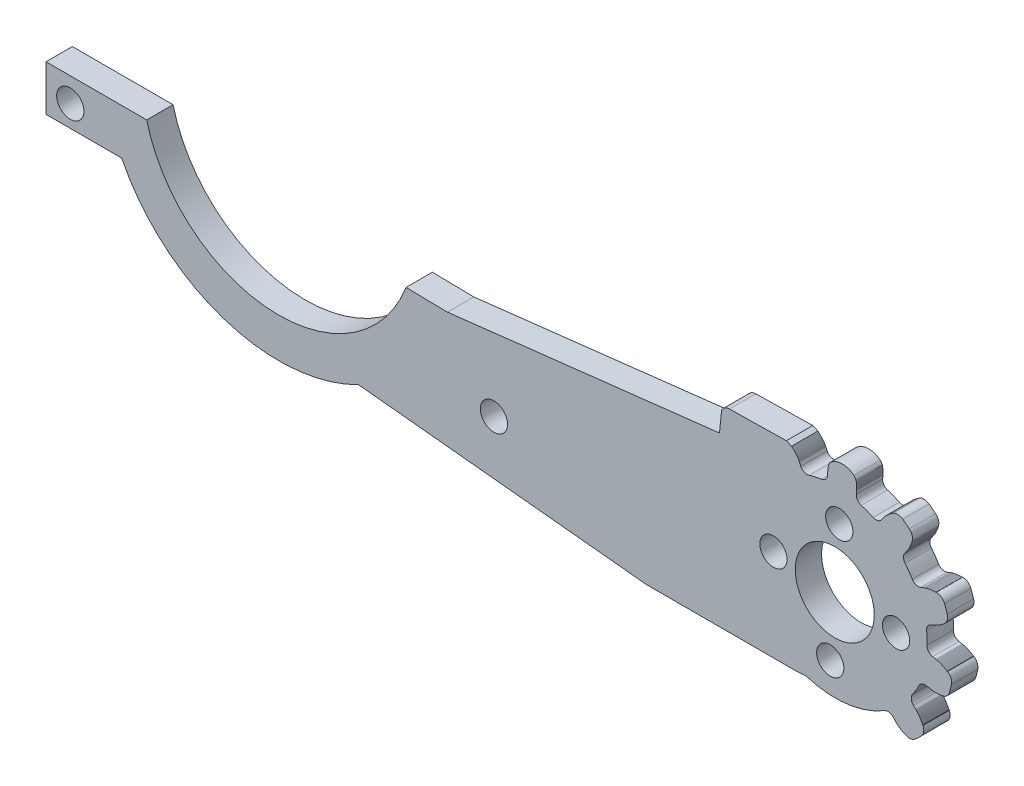
from build123d import *

# Parameters (mm, degrees)
MODEL_R         = 1.55
MODEL_R_2       = 4.5
EXTRUDE_2_DEPTH = 3


with BuildPart() as part:
    # Model → 凸台-拉伸2 (new body)
    with BuildSketch(Plane.XY):
        with BuildLine():
            Line((3139.663510307, 1742.758566379), (3139.638097156, 1742.78410378))
            Line((3139.638097156, 1742.78410378), (3139.612530501, 1742.809490891))
            Line((3139.612530501, 1742.809490891), (3139.586810582, 1742.834725149))
            Line((3139.586810582, 1742.834725149), (3139.560937635, 1742.859803985))
            Line((3139.560937635, 1742.859803985), (3139.534911899, 1742.884724835))
            Line((3139.534911899, 1742.884724835), (3139.50873361, 1742.909485133))
            Line((3139.50873361, 1742.909485133), (3139.482403007, 1742.934082313))
            Line((3139.482403007, 1742.934082313), (3139.455920327, 1742.958513808))
            Line((3139.455920327, 1742.958513808), (3139.429285808, 1742.982777054))
            Line((3139.429285808, 1742.982777054), (3139.402499688, 1743.006869483))
            Line((3139.402499688, 1743.006869483), (3139.375562203, 1743.030788531))
            Line((3139.375562203, 1743.030788531), (3138.787595663, 1743.278189335))
            Line((3138.787595663, 1743.278189335), (3132.295150007, 1743.16338335))
            ThreePointArc((3132.295150007, 1743.16338335), (3131.773064009, 1743.005354602), (3131.41158377, 1742.596846449))
            Line((3131.41158377, 1742.596846449), (3131.169689907, 1740.231347271))
            Line((3131.169689907, 1740.231347271), (3100.200748357, 1736.66283776))
            Line((3100.200748357, 1736.66283776), (3095.48364981, 1736.740728943))
            ThreePointArc((3095.48364981, 1736.740728943), (3080.081090695, 1726.790881354), (3065.965920294, 1738.495592324))
            Line((3065.965920294, 1738.495592324), (3054.501030455, 1738.495592324))
            Line((3054.501030455, 1738.495592324), (3054.501030455, 1733.306079725))
            Line((3054.501030455, 1733.306079725), (3063.11902694, 1733.306079725))
            ThreePointArc((3063.11902694, 1733.306079725), (3074.753205887, 1723.264467804), (3090.076497347, 1724.441255198))
            Line((3090.076497347, 1724.441255198), (3122.846026142, 1721.125541793))
            Line((3122.846026142, 1721.125541793), (3140.057167996, 1721.125541793))
            Line((3140.057167996, 1721.125541793), (3141.054402276, 1721.193876364))
            ThreePointArc((3141.054402276, 1721.193876364), (3145.602495688, 1720.75752989), (3149.926329145, 1722.234017669))
            ThreePointArc((3149.926329145, 1722.234017669), (3150.45306627, 1722.352442256), (3150.934654203, 1722.108414708))
            Line((3150.934654203, 1722.108414708), (3151.193091361, 1721.834706726))
            Line((3151.193091361, 1721.834706726), (3151.217910333, 1721.808701189))
            Line((3151.217910333, 1721.808701189), (3151.243020734, 1721.782953349))
            Line((3151.243020734, 1721.782953349), (3151.268421827, 1721.757473603))
            Line((3151.268421827, 1721.757473603), (3151.294112878, 1721.732272347))
            Line((3151.294112878, 1721.732272347), (3151.320093153, 1721.707359978))
            Line((3151.320093153, 1721.707359978), (3151.346361916, 1721.682746892))
            Line((3151.346361916, 1721.682746892), (3151.372918433, 1721.658443487))
            Line((3151.372918433, 1721.658443487), (3151.39976197, 1721.634460159))
            Line((3151.39976197, 1721.634460159), (3151.42689179, 1721.610807304))
            Line((3151.42689179, 1721.610807304), (3151.454307161, 1721.587495319))
            Line((3151.454307161, 1721.587495319), (3151.482007346, 1721.564534602))
            Line((3151.482007346, 1721.564534602), (3151.509991611, 1721.541935548))
            Line((3151.509991611, 1721.541935548), (3151.538259221, 1721.519708553))
            Line((3151.538259221, 1721.519708553), (3151.566809432, 1721.497863996))
            Line((3151.566809432, 1721.497863996), (3151.595638494, 1721.476405724))
            Line((3151.595638494, 1721.476405724), (3151.62473534, 1721.455321702))
            Line((3151.62473534, 1721.455321702), (3151.654087814, 1721.434597527))
            Line((3151.654087814, 1721.434597527), (3151.683683759, 1721.414218795))
            Line((3151.683683759, 1721.414218795), (3151.713511018, 1721.394171104))
            Line((3151.713511018, 1721.394171104), (3151.743557434, 1721.374440049))
            Line((3151.743557434, 1721.374440049), (3151.77381085, 1721.355011227))
            Line((3151.77381085, 1721.355011227), (3151.80425911, 1721.335870234))
            Line((3151.80425911, 1721.335870234), (3151.834890056, 1721.317002667))
            Line((3151.834890056, 1721.317002667), (3151.865691531, 1721.298394122))
            Line((3151.865691531, 1721.298394122), (3151.89665138, 1721.280030197))
            Line((3151.89665138, 1721.280030197), (3151.927757444, 1721.261896486))
            Line((3151.927757444, 1721.261896486), (3151.958997567, 1721.243978587))
            Line((3151.958997567, 1721.243978587), (3151.990359592, 1721.226262096))
            Line((3151.990359592, 1721.226262096), (3152.021832122, 1721.208733751))
            Line((3152.021832122, 1721.208733751), (3152.05341058, 1721.191390506))
            Line((3152.05341058, 1721.191390506), (3152.085093981, 1721.17423471))
            Line((3152.085093981, 1721.17423471), (3152.116881374, 1721.157268756))
            Line((3152.116881374, 1721.157268756), (3152.14877181, 1721.14049504))
            Line((3152.14877181, 1721.14049504), (3152.180764336, 1721.123915956))
            Line((3152.180764336, 1721.123915956), (3152.212858002, 1721.107533901))
            Line((3152.212858002, 1721.107533901), (3152.245051857, 1721.091351268))
            Line((3152.245051857, 1721.091351268), (3152.27734495, 1721.075370453))
            Line((3152.27734495, 1721.075370453), (3152.30973633, 1721.05959385))
            Line((3152.30973633, 1721.05959385), (3152.342225046, 1721.044023856))
            Line((3152.342225046, 1721.044023856), (3152.37958269, 1721.038871662))
            ThreePointArc((3152.37958269, 1721.038871662), (3152.951559894, 1720.957776932), (3153.471219949, 1721.210141162))
            ThreePointArc((3153.471219949, 1721.210141162), (3153.817896415, 1721.527803864), (3154.153528447, 1721.857114209))
            ThreePointArc((3154.153528447, 1721.857114209), (3154.414147325, 1722.387622272), (3154.333831382, 1722.973207752))
            Line((3154.333831382, 1722.973207752), (3154.308087967, 1723.000997345))
            Line((3154.308087967, 1723.000997345), (3154.292665375, 1723.033556293))
            Line((3154.292665375, 1723.033556293), (3154.277035737, 1723.066018841))
            Line((3154.277035737, 1723.066018841), (3154.261201442, 1723.09838403))
            Line((3154.261201442, 1723.09838403), (3154.245164882, 1723.130650896))
            Line((3154.245164882, 1723.130650896), (3154.228928447, 1723.162818478))
            Line((3154.228928447, 1723.162818478), (3154.212494528, 1723.194885814))
            Line((3154.212494528, 1723.194885814), (3154.195865515, 1723.226851942))
            Line((3154.195865515, 1723.226851942), (3154.1790438, 1723.258715901))
            Line((3154.1790438, 1723.258715901), (3154.162031773, 1723.290476729))
            Line((3154.162031773, 1723.290476729), (3154.144831824, 1723.322133464))
            Line((3154.144831824, 1723.322133464), (3154.127446295, 1723.353685112))
            Line((3154.127446295, 1723.353685112), (3154.109872123, 1723.385127108))
            Line((3154.109872123, 1723.385127108), (3154.092095992, 1723.416448116))
            Line((3154.092095992, 1723.416448116), (3154.074103445, 1723.447636045))
            Line((3154.074103445, 1723.447636045), (3154.055880021, 1723.478678802))
            Line((3154.055880021, 1723.478678802), (3154.037411264, 1723.509564298))
            Line((3154.037411264, 1723.509564298), (3154.018682714, 1723.54028044))
            Line((3154.018682714, 1723.54028044), (3153.999679913, 1723.570815136))
            Line((3153.999679913, 1723.570815136), (3153.980388402, 1723.601156295))
            Line((3153.980388402, 1723.601156295), (3153.960793724, 1723.631291826))
            Line((3153.960793724, 1723.631291826), (3153.940881419, 1723.661209637))
            Line((3153.940881419, 1723.661209637), (3153.920637029, 1723.690897637))
            Line((3153.920637029, 1723.690897637), (3153.900046096, 1723.720343734))
            Line((3153.900046096, 1723.720343734), (3153.879094161, 1723.749535837))
            Line((3153.879094161, 1723.749535837), (3153.857766766, 1723.778461854))
            Line((3153.857766766, 1723.778461854), (3153.836051826, 1723.807110775))
            Line((3153.836051826, 1723.807110775), (3153.813953173, 1723.83547883))
            Line((3153.813953173, 1723.83547883), (3153.791481179, 1723.863565229))
            Line((3153.791481179, 1723.863565229), (3153.768646237, 1723.89136919))
            Line((3153.768646237, 1723.89136919), (3153.745458742, 1723.918889932))
            Line((3153.745458742, 1723.918889932), (3153.721929086, 1723.946126671))
            Line((3153.721929086, 1723.946126671), (3153.698067662, 1723.973078627))
            Line((3153.698067662, 1723.973078627), (3153.673884864, 1723.999745018))
            Line((3153.673884864, 1723.999745018), (3153.649391085, 1724.026125061))
            Line((3153.649391085, 1724.026125061), (3153.624596717, 1724.052217975))
            Line((3153.624596717, 1724.052217975), (3153.599512155, 1724.078022977))
            Line((3153.599512155, 1724.078022977), (3153.574147791, 1724.103539287))
            Line((3153.574147791, 1724.103539287), (3153.548514019, 1724.128766122))
            Line((3153.548514019, 1724.128766122), (3153.522621231, 1724.153702699))
            Line((3153.522621231, 1724.153702699), (3153.25008733, 1724.413377681))
            ThreePointArc((3153.25008733, 1724.413377681), (3153.008244319, 1724.896071501), (3153.129060811, 1725.422269887))
            ThreePointArc((3153.129060811, 1725.422269887), (3153.520833053, 1726.029453854), (3153.870724606, 1726.661698871))
            ThreePointArc((3153.870724606, 1726.661698871), (3154.224261869, 1727.021636284), (3154.726117947, 1727.07344375))
            Line((3154.726117947, 1727.07344375), (3155.104413109, 1727.03499641))
            Line((3155.104413109, 1727.03499641), (3155.139351813, 1727.026537309))
            Line((3155.139351813, 1727.026537309), (3155.174396359, 1727.018452555))
            Line((3155.174396359, 1727.018452555), (3155.209540509, 1727.010750496))
            Line((3155.209540509, 1727.010750496), (3155.244778024, 1727.003439481))
            Line((3155.244778024, 1727.003439481), (3155.280102666, 1726.99652786))
            Line((3155.280102666, 1726.99652786), (3155.315508194, 1726.99002398))
            Line((3155.315508194, 1726.99002398), (3155.350988371, 1726.983936192))
            Line((3155.350988371, 1726.983936192), (3155.386536957, 1726.978272844))
            Line((3155.386536957, 1726.978272844), (3155.422147713, 1726.973042285))
            Line((3155.422147713, 1726.973042285), (3155.457814401, 1726.968252864))
            Line((3155.457814401, 1726.968252864), (3155.49353078, 1726.963912929))
            Line((3155.49353078, 1726.963912929), (3155.529290613, 1726.960030831))
            Line((3155.529290613, 1726.960030831), (3155.56508766, 1726.956614918))
            Line((3155.56508766, 1726.956614918), (3155.600915686, 1726.953673516))
            Line((3155.600915686, 1726.953673516), (3155.636769454, 1726.951207836))
            Line((3155.636769454, 1726.951207836), (3155.672646161, 1726.949201771))
            Line((3155.672646161, 1726.949201771), (3155.708543369, 1726.947636631))
            Line((3155.708543369, 1726.947636631), (3155.744458636, 1726.946493727))
            Line((3155.744458636, 1726.946493727), (3155.780389523, 1726.94575437))
            Line((3155.780389523, 1726.94575437), (3155.816333591, 1726.945399869))
            Line((3155.816333591, 1726.945399869), (3155.852288398, 1726.945411535))
            Line((3155.852288398, 1726.945411535), (3155.888251506, 1726.945770679))
            Line((3155.888251506, 1726.945770679), (3155.924220475, 1726.946458612))
            Line((3155.924220475, 1726.946458612), (3155.960192864, 1726.947456643))
            Line((3155.960192864, 1726.947456643), (3155.996166233, 1726.948746083))
            Line((3155.996166233, 1726.948746083), (3156.032138144, 1726.950308243))
            Line((3156.032138144, 1726.950308243), (3156.068106155, 1726.952124433))
            Line((3156.068106155, 1726.952124433), (3156.104067827, 1726.954175963))
            Line((3156.104067827, 1726.954175963), (3156.140020744, 1726.956445515))
            Line((3156.140020744, 1726.956445515), (3156.175962699, 1726.958928052))
            Line((3156.175962699, 1726.958928052), (3156.211891596, 1726.961625018))
            Line((3156.211891596, 1726.961625018), (3156.24780534, 1726.964537912))
            Line((3156.24780534, 1726.964537912), (3156.283701837, 1726.967668235))
            Line((3156.283701837, 1726.967668235), (3156.319578992, 1726.971017488))
            Line((3156.319578992, 1726.971017488), (3156.35543471, 1726.974587171))
            Line((3156.35543471, 1726.974587171), (3156.391266896, 1726.978378786))
            Line((3156.391266896, 1726.978378786), (3156.427073455, 1726.982393833))
            Line((3156.427073455, 1726.982393833), (3156.462852293, 1726.986633813))
            Line((3156.462852293, 1726.986633813), (3156.498601315, 1726.991100226))
            Line((3156.498601315, 1726.991100226), (3156.532342402, 1727.010464502))
            ThreePointArc((3156.532342402, 1727.010464502), (3157.05555997, 1727.250680925), (3157.355188417, 1727.742293932))
            ThreePointArc((3157.355188417, 1727.742293932), (3157.478481136, 1728.195952654), (3157.585965752, 1728.653614525))
            ThreePointArc((3157.585965752, 1728.653614525), (3157.518246227, 1729.242800729), (3157.132810016, 1729.693539283))
            Line((3157.132810016, 1729.693539283), (3157.094370696, 1729.700236824))
            Line((3157.094370696, 1729.700236824), (3157.06379369, 1729.719289071))
            Line((3157.06379369, 1729.719289071), (3157.033094622, 1729.738148285))
            Line((3157.033094622, 1729.738148285), (3157.002276024, 1729.756814948))
            Line((3157.002276024, 1729.756814948), (3156.971340426, 1729.775289544))
            Line((3156.971340426, 1729.775289544), (3156.94029036, 1729.793572556))
            Line((3156.94029036, 1729.793572556), (3156.909128357, 1729.811664468))
            Line((3156.909128357, 1729.811664468), (3156.877856948, 1729.829565764))
            Line((3156.877856948, 1729.829565764), (3156.846478663, 1729.847276926))
            Line((3156.846478663, 1729.847276926), (3156.814996035, 1729.864798438))
            Line((3156.814996035, 1729.864798438), (3156.783411595, 1729.882130784))
            Line((3156.783411595, 1729.882130784), (3156.751727849, 1729.899274393))
            Line((3156.751727849, 1729.899274393), (3156.719944688, 1729.916223768))
            Line((3156.719944688, 1729.916223768), (3156.688057039, 1729.932962175))
            Line((3156.688057039, 1729.932962175), (3156.656059278, 1729.949471625))
            Line((3156.656059278, 1729.949471625), (3156.623945776, 1729.965734128))
            Line((3156.623945776, 1729.965734128), (3156.591710909, 1729.981731696))
            Line((3156.591710909, 1729.981731696), (3156.559349051, 1729.99744634))
            Line((3156.559349051, 1729.99744634), (3156.526854574, 1730.012860071))
            Line((3156.526854574, 1730.012860071), (3156.494221854, 1730.027954901))
            Line((3156.494221854, 1730.027954901), (3156.461445263, 1730.04271284))
            Line((3156.461445263, 1730.04271284), (3156.428519176, 1730.057115899))
            Line((3156.428519176, 1730.057115899), (3156.395437967, 1730.071146091))
            Line((3156.395437967, 1730.071146091), (3156.36219601, 1730.084785425))
            Line((3156.36219601, 1730.084785425), (3156.328787679, 1730.098015914))
            Line((3156.328787679, 1730.098015914), (3156.295207347, 1730.110819567))
            Line((3156.295207347, 1730.110819567), (3156.261450801, 1730.12318059))
            Line((3156.261450801, 1730.12318059), (3156.227523302, 1730.135097882))
            Line((3156.227523302, 1730.135097882), (3156.193434004, 1730.146576388))
            Line((3156.193434004, 1730.146576388), (3156.159192072, 1730.157621067))
            Line((3156.159192072, 1730.157621067), (3156.124806674, 1730.168236881))
            Line((3156.124806674, 1730.168236881), (3156.090286974, 1730.178428792))
            Line((3156.090286974, 1730.178428792), (3156.05564214, 1730.188201761))
            Line((3156.05564214, 1730.188201761), (3156.020881336, 1730.197560748))
            Line((3156.020881336, 1730.197560748), (3155.98601373, 1730.206510716))
            Line((3155.98601373, 1730.206510716), (3155.951048486, 1730.215056625))
            Line((3155.951048486, 1730.215056625), (3155.915994772, 1730.223203436))
            Line((3155.915994772, 1730.223203436), (3155.880861753, 1730.230956111))
            Line((3155.880861753, 1730.230956111), (3155.845658595, 1730.238319611))
            Line((3155.845658595, 1730.238319611), (3155.810394464, 1730.245298898))
            Line((3155.810394464, 1730.245298898), (3155.440733462, 1730.316408442))
            ThreePointArc((3155.440733462, 1730.316408442), (3154.976318193, 1730.59172612), (3154.793471169, 1731.099710698))
            ThreePointArc((3154.793471169, 1731.099710698), (3154.797749771, 1731.822440811), (3154.752118303, 1732.543741645))
            ThreePointArc((3154.752118303, 1732.543741645), (3154.85415319, 1733.034649437), (3155.245860761, 1733.347645854))
            Line((3155.245860761, 1733.347645854), (3155.583337483, 1733.524378665))
            Line((3155.583337483, 1733.524378665), (3155.617303126, 1733.536151706))
            Line((3155.617303126, 1733.536151706), (3155.651155422, 1733.54829689))
            Line((3155.651155422, 1733.54829689), (3155.68488461, 1733.560817867))
            Line((3155.68488461, 1733.560817867), (3155.718480927, 1733.57371829))
            Line((3155.718480927, 1733.57371829), (3155.751934611, 1733.587001807))
            Line((3155.751934611, 1733.587001807), (3155.7852359, 1733.600672069))
            Line((3155.7852359, 1733.600672069), (3155.818375031, 1733.614732728))
            Line((3155.818375031, 1733.614732728), (3155.851342242, 1733.629187432))
            Line((3155.851342242, 1733.629187432), (3155.88412777, 1733.644039834))
            Line((3155.88412777, 1733.644039834), (3155.916721853, 1733.659293584))
            Line((3155.916721853, 1733.659293584), (3155.94911473, 1733.674952332))
            Line((3155.94911473, 1733.674952332), (3155.981296636, 1733.691019728))
            Line((3155.981296636, 1733.691019728), (3156.013257811, 1733.707499423))
            Line((3156.013257811, 1733.707499423), (3156.044988505, 1733.724395052))
            Line((3156.044988505, 1733.724395052), (3156.076483662, 1733.7417048))
            Line((3156.076483662, 1733.7417048), (3156.107749629, 1733.759413604))
            Line((3156.107749629, 1733.759413604), (3156.13879446, 1733.77750442))
            Line((3156.13879446, 1733.77750442), (3156.169626206, 1733.795960207))
            Line((3156.169626206, 1733.795960207), (3156.200252919, 1733.814763924))
            Line((3156.200252919, 1733.814763924), (3156.23068265, 1733.833898529))
            Line((3156.23068265, 1733.833898529), (3156.260923452, 1733.85334698))
            Line((3156.260923452, 1733.85334698), (3156.290983375, 1733.873092236))
            Line((3156.290983375, 1733.873092236), (3156.320870473, 1733.893117254))
            Line((3156.320870473, 1733.893117254), (3156.350592796, 1733.913404993))
            Line((3156.350592796, 1733.913404993), (3156.380158396, 1733.933938411))
            Line((3156.380158396, 1733.933938411), (3156.409575325, 1733.954700466))
            Line((3156.409575325, 1733.954700466), (3156.438851636, 1733.975674117))
            Line((3156.438851636, 1733.975674117), (3156.467995378, 1733.996842322))
            Line((3156.467995378, 1733.996842322), (3156.497013884, 1734.018189205))
            Line((3156.497013884, 1734.018189205), (3156.52590802, 1734.039709336))
            Line((3156.52590802, 1734.039709336), (3156.554675242, 1734.061402796))
            Line((3156.554675242, 1734.061402796), (3156.583312977, 1734.083269715))
            Line((3156.583312977, 1734.083269715), (3156.611818651, 1734.105310221))
            Line((3156.611818651, 1734.105310221), (3156.640189691, 1734.127524447))
            Line((3156.640189691, 1734.127524447), (3156.668423524, 1734.14991252))
            Line((3156.668423524, 1734.14991252), (3156.696517575, 1734.172474572))
            Line((3156.696517575, 1734.172474572), (3156.724469271, 1734.195210732))
            Line((3156.724469271, 1734.195210732), (3156.752276039, 1734.21812113))
            Line((3156.752276039, 1734.21812113), (3156.779935305, 1734.241205897))
            Line((3156.779935305, 1734.241205897), (3156.79856583, 1734.274898007))
            ThreePointArc((3156.79856583, 1734.274898007), (3157.109192733, 1734.760366943), (3157.095482508, 1735.336545033))
            ThreePointArc((3157.095482508, 1735.336545033), (3156.952873917, 1735.784542344), (3156.79453575, 1736.227224879))
            ThreePointArc((3156.79453575, 1736.227224879), (3156.419542297, 1736.685580135), (3155.852422868, 1736.856123926))
            Line((3155.852422868, 1736.856123926), (3155.816458576, 1736.842373876))
            Line((3155.816458576, 1736.842373876), (3155.78043514, 1736.841870468))
            Line((3155.78043514, 1736.841870468), (3155.74441338, 1736.841138679))
            Line((3155.74441338, 1736.841138679), (3155.708395165, 1736.840180283))
            Line((3155.708395165, 1736.840180283), (3155.672382364, 1736.838997055))
            Line((3155.672382364, 1736.838997055), (3155.636376843, 1736.837590771))
            Line((3155.636376843, 1736.837590771), (3155.600380472, 1736.835963205))
            Line((3155.600380472, 1736.835963205), (3155.564395117, 1736.834116133))
            Line((3155.564395117, 1736.834116133), (3155.528422648, 1736.83205133))
            Line((3155.528422648, 1736.83205133), (3155.492464931, 1736.82977057))
            Line((3155.492464931, 1736.82977057), (3155.456523835, 1736.827275629))
            Line((3155.456523835, 1736.827275629), (3155.420601237, 1736.824568224))
            Line((3155.420601237, 1736.824568224), (3155.384700016, 1736.821643672))
            Line((3155.384700016, 1736.821643672), (3155.348824954, 1736.818485152))
            Line((3155.348824954, 1736.818485152), (3155.312981041, 1736.815074489))
            Line((3155.312981041, 1736.815074489), (3155.277173272, 1736.811393507))
            Line((3155.277173272, 1736.811393507), (3155.241406638, 1736.807424033))
            Line((3155.241406638, 1736.807424033), (3155.205686132, 1736.803147891))
            Line((3155.205686132, 1736.803147891), (3155.170016746, 1736.798546907))
            Line((3155.170016746, 1736.798546907), (3155.134403474, 1736.793602905))
            Line((3155.134403474, 1736.793602905), (3155.098851307, 1736.78829771))
            Line((3155.098851307, 1736.78829771), (3155.063365238, 1736.782613149))
            Line((3155.063365238, 1736.782613149), (3155.02795026, 1736.776531045))
            Line((3155.02795026, 1736.776531045), (3154.992611366, 1736.770033224))
            Line((3154.992611366, 1736.770033224), (3154.957353547, 1736.763101512))
            Line((3154.957353547, 1736.763101512), (3154.922181796, 1736.755717732))
            Line((3154.922181796, 1736.755717732), (3154.887101109, 1736.74786632))
            Line((3154.887101109, 1736.74786632), (3154.852116506, 1736.739549193))
            Line((3154.852116506, 1736.739549193), (3154.817233015, 1736.73077546))
            Line((3154.817233015, 1736.73077546), (3154.782455665, 1736.72155425))
            Line((3154.782455665, 1736.72155425), (3154.747789484, 1736.711894692))
            Line((3154.747789484, 1736.711894692), (3154.713239502, 1736.701805914))
            Line((3154.713239502, 1736.701805914), (3154.678810747, 1736.691297047))
            Line((3154.678810747, 1736.691297047), (3154.644508247, 1736.680377219))
            Line((3154.644508247, 1736.680377219), (3154.610337032, 1736.669055559))
            Line((3154.610337032, 1736.669055559), (3154.576302131, 1736.657341198))
            Line((3154.576302131, 1736.657341198), (3154.542408571, 1736.645243263))
            Line((3154.542408571, 1736.645243263), (3154.508661382, 1736.632770884))
            Line((3154.508661382, 1736.632770884), (3154.475065592, 1736.61993319))
            Line((3154.475065592, 1736.61993319), (3154.44162623, 1736.606739311))
            Line((3154.44162623, 1736.606739311), (3154.092202884, 1736.46670664))
            ThreePointArc((3154.092202884, 1736.46670664), (3153.917556959, 1736.418851732), (3153.736618426, 1736.411603398))
            ThreePointArc((3153.736618426, 1736.411603398), (3153.387519433, 1736.521523962), (3153.124206022, 1736.775726015))
            ThreePointArc((3153.124206022, 1736.775726015), (3152.731711582, 1737.38237419), (3152.297393611, 1737.959818381))
            ThreePointArc((3152.297393611, 1737.959818381), (3152.115114778, 1738.436560781), (3152.278472597, 1738.920113375))
            Line((3152.278472597, 1738.920113375), (3152.477809377, 1739.242520478))
            Line((3152.477809377, 1739.242520478), (3152.500018108, 1739.270787803))
            Line((3152.500018108, 1739.270787803), (3152.521930289, 1739.299306915))
            Line((3152.521930289, 1739.299306915), (3152.543535736, 1739.328075607))
            Line((3152.543535736, 1739.328075607), (3152.564824262, 1739.357091673))
            Line((3152.564824262, 1739.357091673), (3152.58578568, 1739.386352906))
            Line((3152.58578568, 1739.386352906), (3152.606409805, 1739.415857099))
            Line((3152.606409805, 1739.415857099), (3152.62668645, 1739.445602044))
            Line((3152.62668645, 1739.445602044), (3152.646605429, 1739.475585536))
            Line((3152.646605429, 1739.475585536), (3152.666156556, 1739.505805366))
            Line((3152.666156556, 1739.505805366), (3152.685329644, 1739.536259329))
            Line((3152.685329644, 1739.536259329), (3152.704114508, 1739.566945216))
            Line((3152.704114508, 1739.566945216), (3152.72250096, 1739.597860823))
            Line((3152.72250096, 1739.597860823), (3152.740478815, 1739.62900394))
            Line((3152.740478815, 1739.62900394), (3152.758037907, 1739.660372356))
            Line((3152.758037907, 1739.660372356), (3152.775174962, 1739.69196181))
            Line((3152.775174962, 1739.69196181), (3152.791903466, 1739.723763062))
            Line((3152.791903466, 1739.723763062), (3152.808239406, 1739.755766127))
            Line((3152.808239406, 1739.755766127), (3152.82419877, 1739.787961024))
            Line((3152.82419877, 1739.787961024), (3152.839797543, 1739.820337769))
            Line((3152.839797543, 1739.820337769), (3152.855051714, 1739.852886377))
            Line((3152.855051714, 1739.852886377), (3152.869977268, 1739.885596867))
            Line((3152.869977268, 1739.885596867), (3152.884590194, 1739.918459255))
            Line((3152.884590194, 1739.918459255), (3152.898906478, 1739.951463557))
            Line((3152.898906478, 1739.951463557), (3152.912942108, 1739.98459979))
            Line((3152.912942108, 1739.98459979), (3152.92671307, 1740.01785797))
            Line((3152.92671307, 1740.01785797), (3152.940235351, 1740.051228116))
            Line((3152.940235351, 1740.051228116), (3152.953524938, 1740.084700242))
            Line((3152.953524938, 1740.084700242), (3152.966597819, 1740.118264366))
            Line((3152.966597819, 1740.118264366), (3152.979468743, 1740.151911096))
            Line((3152.979468743, 1740.151911096), (3152.992141375, 1740.185636331))
            Line((3152.992141375, 1740.185636331), (3153.004613533, 1740.219438765))
            Line((3153.004613533, 1740.219438765), (3153.01688298, 1740.253317116))
            Line((3153.01688298, 1740.253317116), (3153.028947481, 1740.287270101))
            Line((3153.028947481, 1740.287270101), (3153.040804802, 1740.321296439))
            Line((3153.040804802, 1740.321296439), (3153.052452707, 1740.355394848))
            Line((3153.052452707, 1740.355394848), (3153.063888961, 1740.389564044))
            Line((3153.063888961, 1740.389564044), (3153.075111328, 1740.423802747))
            Line((3153.075111328, 1740.423802747), (3153.086117574, 1740.458109674))
            Line((3153.086117574, 1740.458109674), (3153.096905462, 1740.492483543))
            Line((3153.096905462, 1740.492483543), (3153.099728288, 1740.529272176))
            ThreePointArc((3153.099728288, 1740.529272176), (3153.098610874, 1741.10876661), (3152.773896168, 1741.588740992))
            ThreePointArc((3152.773896168, 1741.588740992), (3152.408076015, 1741.884255515), (3152.031909321, 1742.166482084))
            ThreePointArc((3152.031909321, 1742.166482084), (3151.471966487, 1742.348141191), (3150.906080128, 1742.185941816))
            Line((3150.906080128, 1742.185941816), (3150.880079677, 1742.159830449))
            Line((3150.880079677, 1742.159830449), (3150.850046997, 1742.139931216))
            Line((3150.850046997, 1742.139931216), (3150.820139199, 1742.119840762))
            Line((3150.820139199, 1742.119840762), (3150.790356897, 1742.099561591))
            Line((3150.790356897, 1742.099561591), (3150.760700702, 1742.079096206))
            Line((3150.760700702, 1742.079096206), (3150.731171225, 1742.05844711))
            Line((3150.731171225, 1742.05844711), (3150.701769079, 1742.037616807))
            Line((3150.701769079, 1742.037616807), (3150.672494875, 1742.0166078))
            Line((3150.672494875, 1742.0166078), (3150.643349225, 1741.995422591))
            Line((3150.643349225, 1741.995422591), (3150.61433274, 1741.974063684))
            Line((3150.61433274, 1741.974063684), (3150.585446033, 1741.952533583))
            Line((3150.585446033, 1741.952533583), (3150.556689754, 1741.930834747))
            Line((3150.556689754, 1741.930834747), (3150.528068858, 1741.908964792))
            Line((3150.528068858, 1741.908964792), (3150.499596459, 1741.886912152))
            Line((3150.499596459, 1741.886912152), (3150.471286585, 1741.864664237))
            Line((3150.471286585, 1741.864664237), (3150.443153261, 1741.842208457))
            Line((3150.443153261, 1741.842208457), (3150.415210514, 1741.81953222))
            Line((3150.415210514, 1741.81953222), (3150.387472369, 1741.796622937))
            Line((3150.387472369, 1741.796622937), (3150.359952852, 1741.773468017))
            Line((3150.359952852, 1741.773468017), (3150.332665991, 1741.750054869))
            Line((3150.332665991, 1741.750054869), (3150.305625809, 1741.726370903))
            Line((3150.305625809, 1741.726370903), (3150.278846335, 1741.702403529))
            Line((3150.278846335, 1741.702403529), (3150.252341593, 1741.678140155))
            Line((3150.252341593, 1741.678140155), (3150.22612561, 1741.653568191))
            Line((3150.22612561, 1741.653568191), (3150.200212412, 1741.628675047))
            Line((3150.200212412, 1741.628675047), (3150.174616025, 1741.603448133))
            Line((3150.174616025, 1741.603448133), (3150.149349067, 1741.577877053))
            Line((3150.149349067, 1741.577877053), (3150.124414724, 1741.551966137))
            Line((3150.124414724, 1741.551966137), (3150.099812302, 1741.525725764))
            Line((3150.099812302, 1741.525725764), (3150.075541096, 1741.499166333))
            Line((3150.075541096, 1741.499166333), (3150.051600401, 1741.472298243))
            Line((3150.051600401, 1741.472298243), (3150.027989511, 1741.445131893))
            Line((3150.027989511, 1741.445131893), (3150.004707722, 1741.417677681))
            Line((3150.004707722, 1741.417677681), (3149.981754328, 1741.389946006))
            Line((3149.981754328, 1741.389946006), (3149.959128624, 1741.361947266))
            Line((3149.959128624, 1741.361947266), (3149.936829905, 1741.333691861))
            Line((3149.936829905, 1741.333691861), (3149.914857465, 1741.305190188))
            Line((3149.914857465, 1741.305190188), (3149.8932106, 1741.276452647))
            Line((3149.8932106, 1741.276452647), (3149.871888604, 1741.247489637))
            Line((3149.871888604, 1741.247489637), (3149.850890773, 1741.218311556))
            Line((3149.850890773, 1741.218311556), (3149.632644526, 1740.911596053))
            ThreePointArc((3149.632644526, 1740.911596053), (3149.321870069, 1740.652033732), (3148.923707724, 1740.578412346))
            ThreePointArc((3148.923707724, 1740.578412346), (3148.784381429, 1740.601216969), (3148.651254183, 1740.648217008))
            ThreePointArc((3148.651254183, 1740.648217008), (3147.987989705, 1740.933004043), (3147.306066144, 1741.169655008))
            ThreePointArc((3147.306066144, 1741.169655008), (3146.879831466, 1741.484053713), (3146.751345984, 1741.997876666))
            Line((3146.751345984, 1741.997876666), (3146.773812023, 1742.373952225))
            Line((3146.773812023, 1742.373952225), (3146.777212726, 1742.409739158))
            Line((3146.777212726, 1742.409739158), (3146.78022783, 1742.445577582))
            Line((3146.78022783, 1742.445577582), (3146.782849959, 1742.481460133))
            Line((3146.782849959, 1742.481460133), (3146.785071737, 1742.517379447))
            Line((3146.785071737, 1742.517379447), (3146.786885788, 1742.553328161))
            Line((3146.786885788, 1742.553328161), (3146.788284735, 1742.589298911))
            Line((3146.788284735, 1742.589298911), (3146.789261202, 1742.625284333))
            Line((3146.789261202, 1742.625284333), (3146.789807815, 1742.661277064))
            Line((3146.789807815, 1742.661277064), (3146.789917195, 1742.69726974))
            Line((3146.789917195, 1742.69726974), (3146.789581968, 1742.733254998))
            Line((3146.789581968, 1742.733254998), (3146.788794757, 1742.769225474))
            Line((3146.788794757, 1742.769225474), (3146.787548187, 1742.805173803))
            Line((3146.787548187, 1742.805173803), (3146.78583488, 1742.841092623))
            Line((3146.78583488, 1742.841092623), (3146.783647483, 1742.876974576))
            Line((3146.783647483, 1742.876974576), (3146.780985543, 1742.912814307))
            Line((3146.780985543, 1742.912814307), (3146.777865401, 1742.948611334))
            Line((3146.777865401, 1742.948611334), (3146.774305905, 1742.984365902))
            Line((3146.774305905, 1742.984365902), (3146.7703259, 1743.020078256))
            Line((3146.7703259, 1743.020078256), (3146.765944234, 1743.05574864))
            Line((3146.765944234, 1743.05574864), (3146.761179752, 1743.0913773))
            Line((3146.761179752, 1743.0913773), (3146.756051302, 1743.126964479))
            Line((3146.756051302, 1743.126964479), (3146.750577729, 1743.162510423))
            Line((3146.750577729, 1743.162510423), (3146.744777881, 1743.198015376))
            Line((3146.744777881, 1743.198015376), (3146.738670604, 1743.233479583))
            Line((3146.738670604, 1743.233479583), (3146.732274744, 1743.268903289))
            Line((3146.732274744, 1743.268903289), (3146.725609148, 1743.304286739))
            Line((3146.725609148, 1743.304286739), (3146.718692663, 1743.339630177))
            ThreePointArc((3146.718692663, 1743.339630177), (3146.614509352, 1743.531985761), (3146.471002302, 1743.697093483))
            ThreePointArc((3146.471002302, 1743.697093483), (3145.049014924, 1744.164993133), (3143.685982315, 1743.546026015))
            Line((3143.685982315, 1743.546026015), (3143.67996734, 1743.529053414))
            Line((3143.67996734, 1743.529053414), (3143.66817969, 1743.495031804))
            Line((3143.66817969, 1743.495031804), (3143.656652943, 1743.460930776))
            Line((3143.656652943, 1743.460930776), (3143.645405707, 1743.426747322))
            Line((3143.645405707, 1743.426747322), (3143.634456588, 1743.392478434))
            Line((3143.634456588, 1743.392478434), (3143.623824193, 1743.358121101))
            Line((3143.623824193, 1743.358121101), (3143.613527127, 1743.323672317))
            Line((3143.613527127, 1743.323672317), (3143.603583998, 1743.289129071))
            Line((3143.603583998, 1743.289129071), (3143.594013411, 1743.254488355))
            Line((3143.594013411, 1743.254488355), (3143.584833974, 1743.219747161))
            Line((3143.584833974, 1743.219747161), (3143.576064292, 1743.184902479))
            Line((3143.576064292, 1743.184902479), (3143.567722972, 1743.149951301))
            Line((3143.567722972, 1743.149951301), (3143.559828621, 1743.114890619))
            Line((3143.559828621, 1743.114890619), (3143.552397473, 1743.079718509))
            Line((3143.552397473, 1743.079718509), (3143.545429868, 1743.044440336))
            Line((3143.545429868, 1743.044440336), (3143.53891961, 1743.009064456))
            Line((3143.53891961, 1743.009064456), (3143.532860485, 1742.973599236))
            Line((3143.532860485, 1742.973599236), (3143.527246276, 1742.938053044))
            Line((3143.527246276, 1742.938053044), (3143.52207077, 1742.902434245))
            Line((3143.52207077, 1742.902434245), (3143.51732775, 1742.866751206))
            Line((3143.51732775, 1742.866751206), (3143.513011002, 1742.831012295))
            Line((3143.513011002, 1742.831012295), (3143.50911431, 1742.795225877))
            Line((3143.50911431, 1742.795225877), (3143.505631459, 1742.75940032))
            Line((3143.505631459, 1742.75940032), (3143.502556234, 1742.723543989))
            Line((3143.502556234, 1742.723543989), (3143.49988242, 1742.687665253))
            Line((3143.49988242, 1742.687665253), (3143.497603801, 1742.651772477))
            Line((3143.497603801, 1742.651772477), (3143.495714163, 1742.615874028))
            Line((3143.495714163, 1742.615874028), (3143.477936657, 1742.239855699))
            ThreePointArc((3143.477936657, 1742.239855699), (3143.271517797, 1741.740989348), (3142.794732026, 1741.487707469))
            ThreePointArc((3142.794732026, 1741.487707469), (3142.087088522, 1741.351892967), (3141.390950255, 1741.165891831))
            ThreePointArc((3141.390950255, 1741.165891831), (3140.838931728, 1741.201358092), (3140.435896807, 1741.580231637))
            Line((3140.435896807, 1741.580231637), (3140.282324277, 1741.924466453))
            Line((3140.282324277, 1741.924466453), (3140.265837254, 1741.956410896))
            Line((3140.265837254, 1741.956410896), (3140.248998007, 1741.988190185))
            Line((3140.248998007, 1741.988190185), (3140.23180431, 1742.019794138))
            Line((3140.23180431, 1742.019794138), (3140.214253941, 1742.051212571))
            Line((3140.214253941, 1742.051212571), (3140.196344676, 1742.082435304))
            Line((3140.196344676, 1742.082435304), (3140.178074289, 1742.113452152))
            Line((3140.178074289, 1742.113452152), (3140.159440558, 1742.144252934))
            Line((3140.159440558, 1742.144252934), (3140.140441258, 1742.174827467))
            Line((3140.140441258, 1742.174827467), (3140.121074165, 1742.205165569))
            Line((3140.121074165, 1742.205165569), (3140.101337055, 1742.235257056))
            Line((3140.101337055, 1742.235257056), (3140.081227704, 1742.265091748))
            Line((3140.081227704, 1742.265091748), (3140.060743887, 1742.29465946))
            Line((3140.060743887, 1742.29465946), (3140.039883382, 1742.323950011))
            Line((3140.039883382, 1742.323950011), (3140.018643978, 1742.352953234))
            Line((3140.018643978, 1742.352953234), (3139.99702819, 1742.381664381))
            Line((3139.99702819, 1742.381664381), (3139.975050026, 1742.410091881))
            Line((3139.975050026, 1742.410091881), (3139.952725208, 1742.438246128))
            Line((3139.952725208, 1742.438246128), (3139.930069459, 1742.466137519))
            Line((3139.930069459, 1742.466137519), (3139.907098501, 1742.493776448))
            Line((3139.907098501, 1742.493776448), (3139.883828056, 1742.521173311))
            Line((3139.883828056, 1742.521173311), (3139.860273847, 1742.548338501))
            Line((3139.860273847, 1742.548338501), (3139.836451597, 1742.575282415))
            Line((3139.836451597, 1742.575282415), (3139.812377028, 1742.602015448))
            Line((3139.812377028, 1742.602015448), (3139.788065861, 1742.628547994))
            Line((3139.788065861, 1742.628547994), (3139.76353382, 1742.654890449))
            Line((3139.76353382, 1742.654890449), (3139.738796627, 1742.681053208))
            Line((3139.738796627, 1742.681053208), (3139.713870004, 1742.707046666))
            Line((3139.713870004, 1742.707046666), (3139.688769673, 1742.732881218))
            Line((3139.688769673, 1742.732881218), (3139.663510307, 1742.758566379))
        make_face()
        with Locations((3143.778277076, 1724.114205591)):
            Circle(MODEL_R, mode=Mode.SUBTRACT)
        with Locations((3057.270179502, 1735.756060766)):
            Circle(MODEL_R, mode=Mode.SUBTRACT)
        with Locations((3105.492713242, 1729.012314307)):
            Circle(MODEL_R, mode=Mode.SUBTRACT)
        with Locations((3144.293472129, 1731.095220851)):
            Circle(MODEL_R_2, mode=Mode.SUBTRACT)
        with Locations((3137.312456869, 1731.610415904)):
            Circle(MODEL_R, mode=Mode.SUBTRACT)
        with Locations((3151.274487417, 1730.580026187)):
            Circle(MODEL_R, mode=Mode.SUBTRACT)
        with Locations((3144.80866718, 1738.07623611)):
            Circle(MODEL_R, mode=Mode.SUBTRACT)
    extrude(amount=EXTRUDE_2_DEPTH)


solid = part.part
